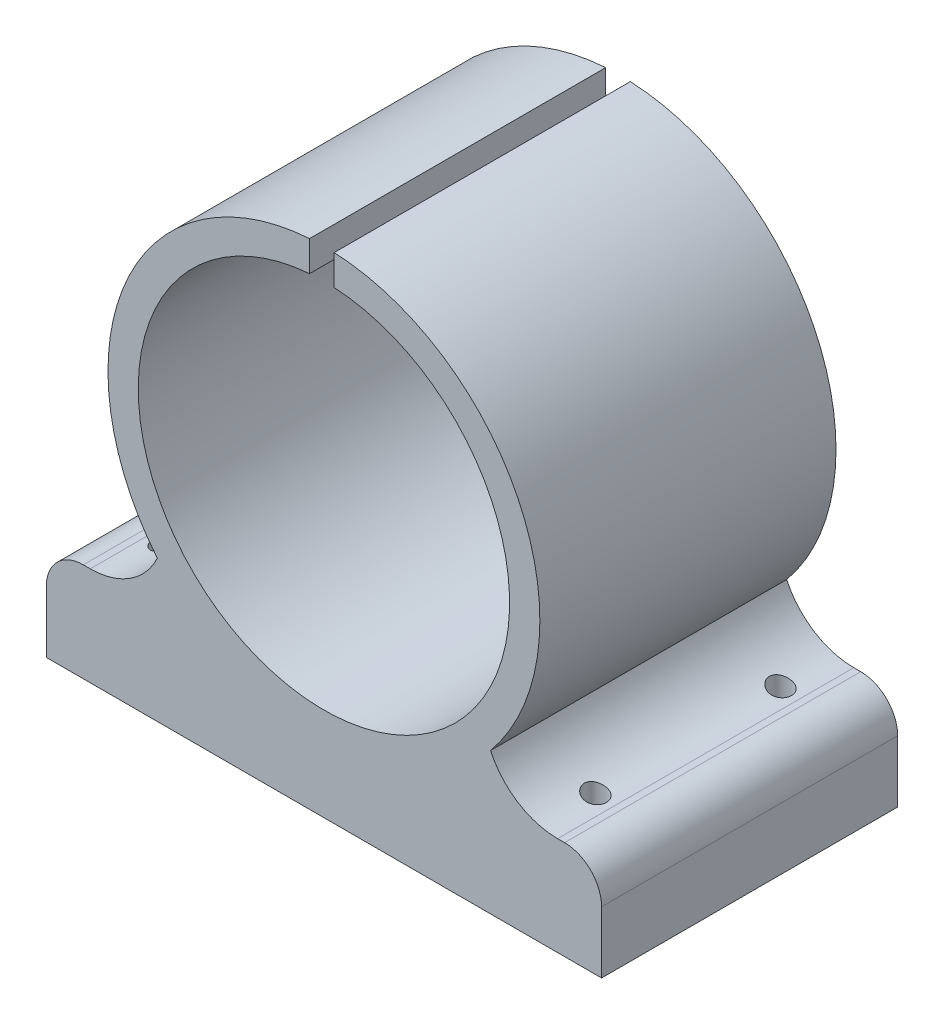
from build123d import *

# Parameters (mm, degrees)
BOSS_EXTRUDE1_DEPTH = 30.48
FILLET1_R           = 7.62
FILLET2_R           = 3.81
CUT_EXTRUDE1_REACH  = 67.853
SKETCH2_R           = 1.143


with BuildPart() as part:
    # Sketch1 → Boss-Extrude1 (new body)
    with BuildSketch(Plane.XY):
        with BuildLine():
            Line((-28.575, 0), (28.575, 0))
            Line((28.575, 0), (28.575, 10.16))
            Line((28.575, 10.16), (17.145, 10.16))
            Line((17.145, 10.16), (17.145, 14.559878518))
            ThreePointArc((17.145, 14.559878518), (20.322966492, 37.697980101), (1.058217697, 50.901792799))
            Line((1.058217697, 50.901792799), (1.058217697, 47.78156187))
            ThreePointArc((1.058217697, 47.78156187), (0.212193658, 9.594292663), (-1.481666667, 47.753356112))
            Line((-1.481666667, 47.753356112), (-1.481666667, 50.877556112))
            ThreePointArc((-1.481666667, 50.877556112), (-20.407880934, 37.503648753), (-17.145, 14.559878518))
            Line((-17.145, 14.559878518), (-17.145, 10.16))
            Line((-17.145, 10.16), (-28.575, 10.16))
            Line((-28.575, 10.16), (-28.575, 0))
        make_face()
    extrude(amount=BOSS_EXTRUDE1_DEPTH)

    # Fillet1
    # the kernel refuses this fillet: 7.62 mm, written as the material it adds along each edge
    with BuildSketch(Plane(origin=(-17.145, 10.16, 0), x_dir=(0, 1, 0), z_dir=(0, 0, 1))) as fillet1_piece_1:
        with BuildLine():
            CenterArc((7.62, 6.906172431), FILLET1_R, 180, 65.001905453)
            Line((0, 6.906172431), (-0.1524, 6.906172431))
            Line((-0.1524, 6.906172431), (-0.1524, 0))
            Line((-0.1524, 0), (0, -0.1524))
            ThreePointArc((0, -0.1524), (2.199939259, -0.1524), (4.335476089, -0.138123449))
            Line((4.335476089, -0.138123449), (4.399878518, 0))
        make_face()
    extrude(amount=30.48)
    with BuildSketch(Plane(origin=(17.145, 10.16, 0), x_dir=(1, 0, 0), z_dir=(0, 0, 1))) as fillet1_piece_2:
        with BuildLine():
            CenterArc((6.906172431, 7.62), FILLET1_R, 204.998094547, 65.001905453)
            Line((0, 4.399878518), (-0.138123449, 4.335476089))
            ThreePointArc((-0.138123449, 4.335476089), (-0.1524, 2.199939259), (-0.1524, 0))
            Line((-0.1524, 0), (0, -0.1524))
            Line((0, -0.1524), (6.906172431, -0.1524))
            Line((6.906172431, -0.1524), (6.906172431, 0))
        make_face()
    extrude(amount=30.48)

    # Fillet2
    fillet2_edges = [part.edges().sort_by_distance(p)[0] for p in [
        (-28.575, 10.16, 15.24),
        (28.575, 10.16, 15.24),
    ]]
    fillet(fillet2_edges, radius=FILLET2_R)

    # Sketch2 → Cut-Extrude1 (cut, up to next)
    with BuildSketch(Plane.XZ, mode=Mode.PRIVATE) as cut_extrude1_sk1:
        with Locations((-22.225, 5.715)):
            Circle(SKETCH2_R)
    cut_extrude1_tool1 = extrude(cut_extrude1_sk1.sketch, amount=-CUT_EXTRUDE1_REACH, mode=Mode.PRIVATE) & part.part
    # Sketch2 → Cut-Extrude1 (cut, up to next)
    with BuildSketch(Plane.XZ, mode=Mode.PRIVATE) as cut_extrude1_sk2:
        with Locations((-22.225, 24.765)):
            Circle(SKETCH2_R)
    cut_extrude1_tool2 = extrude(cut_extrude1_sk2.sketch, amount=-CUT_EXTRUDE1_REACH, mode=Mode.PRIVATE) & part.part
    # Sketch2 → Cut-Extrude1 (cut, up to next)
    with BuildSketch(Plane.XZ, mode=Mode.PRIVATE) as cut_extrude1_sk3:
        with Locations((22.225, 24.765)):
            Circle(SKETCH2_R)
    cut_extrude1_tool3 = extrude(cut_extrude1_sk3.sketch, amount=-CUT_EXTRUDE1_REACH, mode=Mode.PRIVATE) & part.part
    # Sketch2 → Cut-Extrude1 (cut, up to next)
    with BuildSketch(Plane.XZ, mode=Mode.PRIVATE) as cut_extrude1_sk4:
        with Locations((22.225, 5.715)):
            Circle(SKETCH2_R)
    cut_extrude1_tool4 = extrude(cut_extrude1_sk4.sketch, amount=-CUT_EXTRUDE1_REACH, mode=Mode.PRIVATE) & part.part
    add(cut_extrude1_tool1.solids().sort_by_distance((-22.225, 0, 5.715))[0], mode=Mode.SUBTRACT)
    add(cut_extrude1_tool2.solids().sort_by_distance((-22.225, 0, 24.765))[0], mode=Mode.SUBTRACT)
    add(cut_extrude1_tool3.solids().sort_by_distance((22.225, 0, 24.765))[0], mode=Mode.SUBTRACT)
    add(cut_extrude1_tool4.solids().sort_by_distance((22.225, 0, 5.715))[0], mode=Mode.SUBTRACT)


solid = part.part
